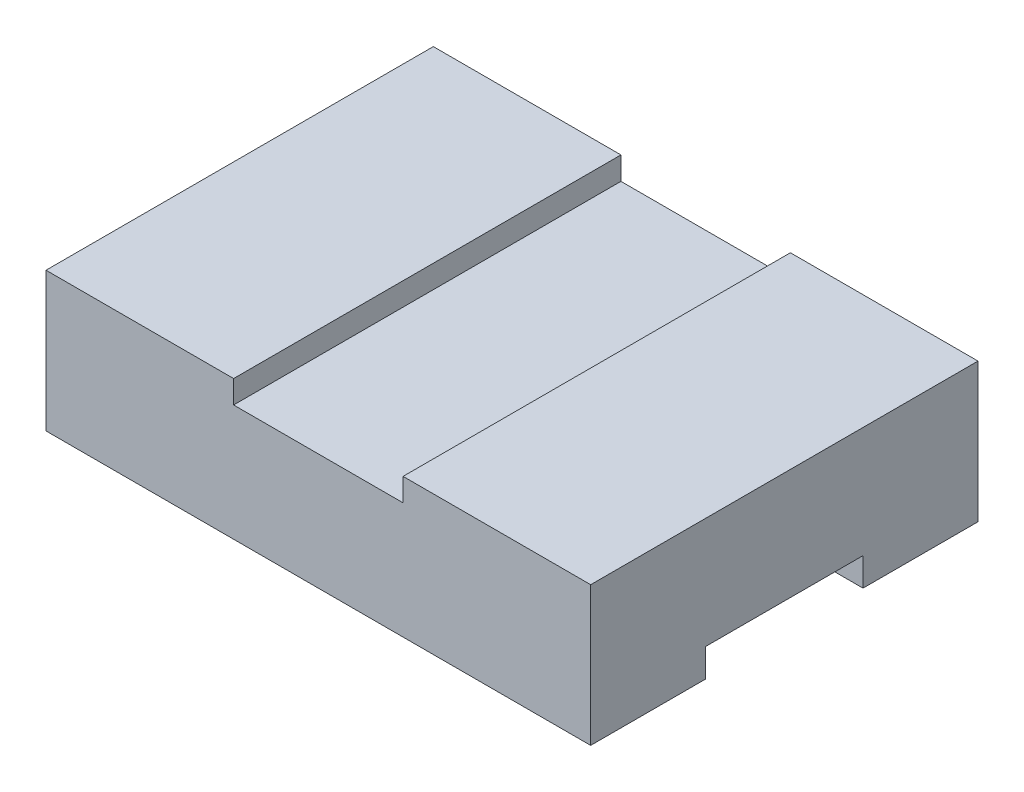
from build123d import *

# Parameters (mm, degrees)
SKETCH1_W           = 90
SKETCH1_H           = 64
BOSS_EXTRUDE1_DEPTH = 23
SKETCH3_W           = 26
SKETCH3_H           = 9.317565448
CUT_EXTRUDE1_DEPTH  = 99.249681933
SKETCH4_W           = 28
SKETCH4_H           = 7.570604484
CUT_EXTRUDE2_DEPTH  = 82.547532152


with BuildPart() as part:
    # Sketch1 → Boss-Extrude1 (new body)
    with BuildSketch(Plane(origin=(0, 0, 0), x_dir=(1, 0, 0), z_dir=(0, 1, 0))):
        Rectangle(SKETCH1_W, SKETCH1_H)
    extrude(amount=BOSS_EXTRUDE1_DEPTH)

    # Sketch3 → Cut-Extrude1 (cut, through all)
    with BuildSketch(Plane.ZY.offset(45)):
        Rectangle(SKETCH3_W, SKETCH3_H)
    extrude(amount=-CUT_EXTRUDE1_DEPTH, mode=Mode.SUBTRACT)

    # Sketch4 → Cut-Extrude2 (cut, through all)
    with BuildSketch(Plane.XY.offset(32)):
        with Locations((0, 23)):
            Rectangle(SKETCH4_W, SKETCH4_H)
    extrude(amount=-CUT_EXTRUDE2_DEPTH, mode=Mode.SUBTRACT)


solid = part.part
